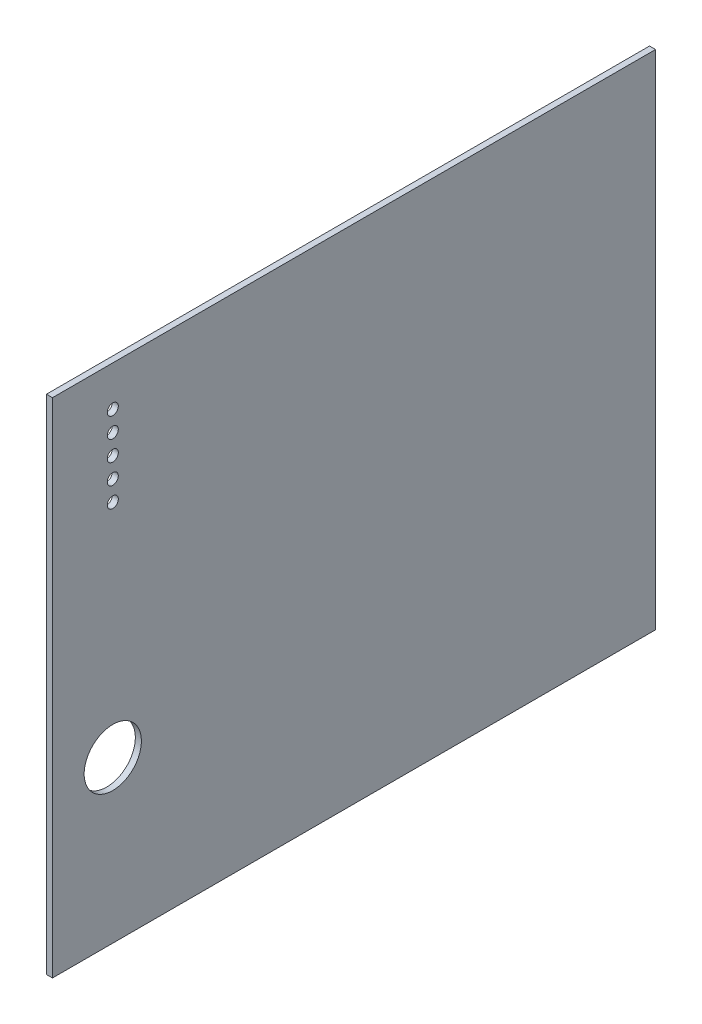
from build123d import *

# Parameters (mm, degrees)
SKETCH1_W           = 300
SKETCH1_H           = 250
SKETCH1_R           = 14.235
BOSS_EXTRUDE1_DEPTH = 3
SKETCH3_R           = 2.75
CUT_EXTRUDE2_DEPTH  = 3


with BuildPart() as part:
    # Sketch1 → Boss-Extrude1 (new body)
    with BuildSketch(Plane(origin=(0, 0, 0), x_dir=(0, 0, -1), z_dir=(1, 0, 0))):
        with Locations((150, 125)):
            Rectangle(SKETCH1_W, SKETCH1_H)
        with Locations((30, 80)):
            Circle(SKETCH1_R, mode=Mode.SUBTRACT)
    extrude(amount=BOSS_EXTRUDE1_DEPTH)

    # Sketch3 → Cut-Extrude2 (cut)
    with BuildSketch(Plane(origin=(3, 0, 0), x_dir=(0, 0, -1), z_dir=(1, 0, 0))):
        with Locations((30, 230)):
            Circle(SKETCH3_R)
        with Locations((30, 220)):
            Circle(SKETCH3_R)
        with Locations((30, 210)):
            Circle(SKETCH3_R)
        with Locations((30, 200)):
            Circle(SKETCH3_R)
        with Locations((30, 190)):
            Circle(SKETCH3_R)
    extrude(amount=-CUT_EXTRUDE2_DEPTH, mode=Mode.SUBTRACT)


solid = part.part
